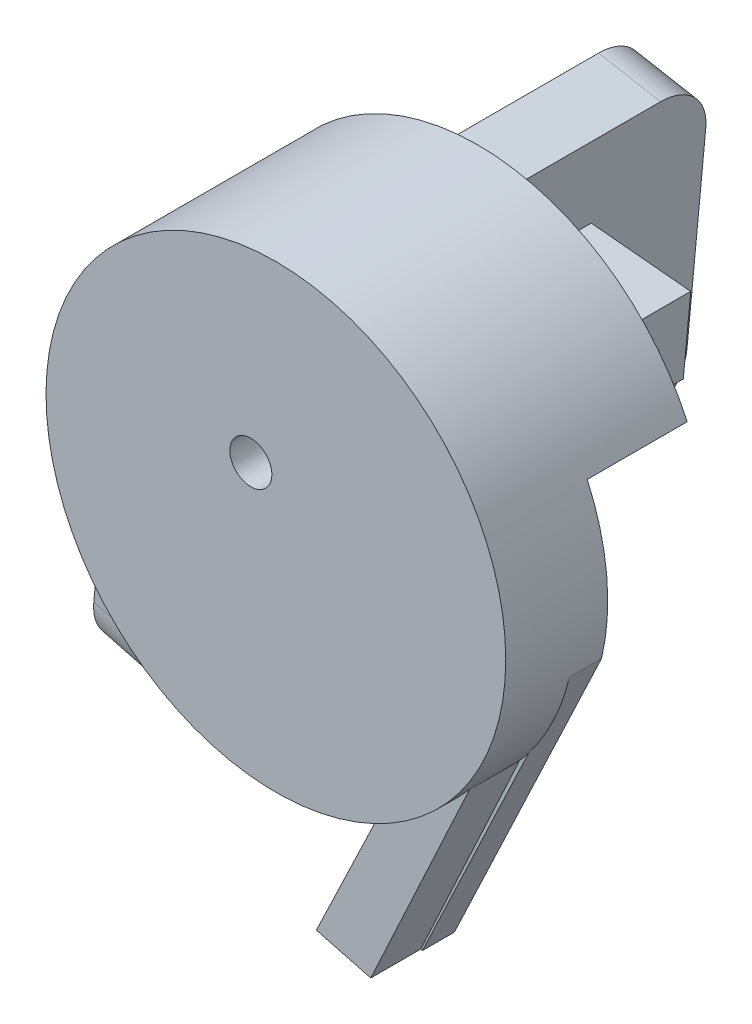
from build123d import *

# Parameters (mm, degrees)
BOSS_EXTRUDE3_DEPTH  = 13.2
BOSS_EXTRUDE4_DEPTH  = 40
SKETCH3_R            = 23
BOSS_EXTRUDE5_DEPTH  = 7
SKETCH4_R            = 2.101716342
CUT_EXTRUDE1_DEPTH   = 10
SKETCH6_W            = 25.714942096
SKETCH6_H            = 53.927163671
CUT_EXTRUDE2_DEPTH   = 10
BOSS_EXTRUDE6_DEPTH  = 5
BOSS_EXTRUDE10_DEPTH = 10
FILLET4_R            = 3
SKETCH10_R           = 1.4
CUT_EXTRUDE4_DEPTH   = 10
SKETCH11_W           = 0.356169872
SKETCH11_H           = 3.96875
SKETCH11_W_2         = 1.526442308
SKETCH11_H_2         = 0.407051282
CUT_EXTRUDE5_DEPTH   = 5
FILLET5_R            = 5
FILLET6_R            = 5
FILLET7_R            = 5


with BuildPart() as part:
    # Sketch1 → Boss-Extrude3 (new body)
    with BuildSketch(Plane.XY):
        with BuildLine():
            ThreePointArc((-16.733879942, 0.734685024), (4.365374373, 16.171147349), (14.830379862, -7.786034495))
            Line((14.830379862, -7.786034495), (1.98558973, -34.897127547))
            Line((1.98558973, -34.897127547), (7.660402975, -36.381590217))
            Line((7.660402975, -36.381590217), (22.375667903, -5.322545058))
            ThreePointArc((22.375667903, -5.322545058), (3.672252171, 22.704945805), (-22.912677541, 2.002300652))
            Line((-22.912677541, 2.002300652), (-25.690659105, -27.657354808))
            Line((-25.690659105, -27.657354808), (-19.543738844, -29.265314976))
            Line((-19.543738844, -29.265314976), (-16.733879942, 0.734685024))
        make_face()
    extrude(amount=BOSS_EXTRUDE3_DEPTH)

    # Sketch2 → Boss-Extrude4 (add)
    with BuildSketch(Plane(origin=(0, 0, 0), x_dir=(-1, 0, 0), z_dir=(0, 0, -1))):
        Polygon((22.912677541, 2.002300652), (16.720636216, 0.876084213), (19.543738844, -29.265314976), (25.690659105, -27.657354808), align=None)
    extrude(amount=BOSS_EXTRUDE4_DEPTH)

    # Sketch3 → Boss-Extrude5 (add)
    with BuildSketch(Plane.XY.offset(13.2)):
        Circle(SKETCH3_R)
    extrude(amount=BOSS_EXTRUDE5_DEPTH)

    # Sketch4 → Cut-Extrude1 (cut)
    with BuildSketch(Plane.XY.offset(20.2)):
        with Locations((-2.506003926, 4.326655096)):
            Circle(SKETCH4_R)
    extrude(amount=-CUT_EXTRUDE1_DEPTH, mode=Mode.SUBTRACT)

    # Sketch6 → Cut-Extrude2 (cut)
    with BuildSketch(Plane(origin=(0, 0, 0), x_dir=(-1, 0, 0), z_dir=(0, 0, -1))):
        with Locations((-13.331770184, -17.473361846)):
            Rectangle(SKETCH6_W, SKETCH6_H)
    extrude(amount=-CUT_EXTRUDE2_DEPTH, mode=Mode.SUBTRACT)

    # Sketch7 → Boss-Extrude6 (add)
    with BuildSketch(Plane.XY.offset(13.2)):
        with BuildLine():
            Line((8.554145329, -21.350095964), (2.050563603, -34.914123928))
            Line((2.050563603, -34.914123928), (7.494260499, -36.33812935))
            Line((7.494260499, -36.33812935), (17.377955101, -15.066740739))
            ThreePointArc((17.377955101, -15.066740739), (13.34123669, -18.735298332), (8.554145329, -21.350095964))
        make_face()
    extrude(amount=BOSS_EXTRUDE6_DEPTH)

    # Sketch8 → Boss-Extrude10 (add)
    with BuildSketch(Plane(origin=(-16.656571158, 1.560087158, 0), x_dir=(0, 0, -1), z_dir=(0.9956423681399388, -0.09325381903544164, 0))):
        Polygon((28.8, -16.5), (28.8, -8.5), (13.8, -8.5), (11.347917338, -14.810453646), (11.536154201, -16.5), align=None)
    extrude(amount=BOSS_EXTRUDE10_DEPTH)

    # Fillet4
    fillet4_edges = [part.edges().sort_by_distance(p)[0] for p in [
        (-12.471016779, -7.369142066, -13.8),
    ]]
    fillet(fillet4_edges, radius=FILLET4_R)

    # Sketch10 → Cut-Extrude4 (cut)
    with BuildSketch(Plane(origin=(-6.700147476, 0.627548968, 0), x_dir=(0, 0, -1), z_dir=(0.9956423681399388, -0.09325381903544165, 0))):
        with Locations((21.360043427, -12.580496566)):
            Circle(SKETCH10_R)
    extrude(amount=-CUT_EXTRUDE4_DEPTH, mode=Mode.SUBTRACT)

    # Sketch11 → Cut-Extrude5 (cut)
    # profile 1 of 10: a face of its own
    with BuildSketch(Plane(origin=(-22.899331118, 2.144796313, 0), x_dir=(0, 0, 1), z_dir=(-0.9956423681399388, 0.09325381903544164, 0))):
        with BuildLine():
            Line((-27.490761449, -14.449425234), (-27.796049911, -14.738813255))
            add(Edge.make_bspline(
                [(-27.796049911, -14.738813255), (-27.85129365, -14.68684433), (-27.96046381, -14.584145708), (-28.138445513, -14.450896634), (-28.324141777, -14.336748466), (-28.516583626, -14.243872645), (-28.711005379, -14.169767282), (-28.904826402, -14.117007695), (-29.096058582, -14.083361157), (-29.223248195, -14.079337559), (-29.285921205, -14.077354922)],
                knots=[0, 0, 0, 0, 1.08915593, 2.152340314, 3.188132944, 4.216796309, 5.218260357, 6.173443236, 7.099959455, 8, 8, 8, 8], degree=3))
            add(Edge.make_bspline(
                [(-29.285921205, -14.077354922), (-29.324378052, -14.077823921), (-29.401192007, -14.078760704), (-29.515290104, -14.090717091), (-29.628191559, -14.107912963), (-29.739683243, -14.132793485), (-29.849981933, -14.164326972), (-29.958704016, -14.203771203), (-30.066052303, -14.249757953), (-30.171015627, -14.302896651), (-30.272774948, -14.36127112), (-30.368883145, -14.42596009), (-30.459952803, -14.494890236), (-30.544272214, -14.569787329), (-30.622326399, -14.649972935), (-30.695973213, -14.733955434), (-30.762622468, -14.824029298), (-30.822824057, -14.918537284), (-30.87652875, -15.015819499), (-30.923936776, -15.114939585), (-30.963734367, -15.215568777), (-30.995222946, -15.317833348), (-31.021201991, -15.420942141), (-31.039478206, -15.525609101), (-31.0497819, -15.631946298), (-31.051564187, -15.703153904), (-31.052460167, -15.738950975)],
                knots=[0, 0, 0, 0, 1.02818874, 2.053710826, 3.065248034, 4.081641283, 5.106893873, 6.131558223, 7.173050175, 8.228653731, 9.27666206, 10.308777013, 11.325269123, 12.329503258, 13.32196095, 14.316845687, 15.314881793, 16.315733098, 17.311955233, 18.285320748, 19.252783886, 20.203351036, 21.145449891, 22.095197417, 23.042428769, 24, 24, 24, 24], degree=3))
            add(Edge.make_bspline(
                [(-31.052460167, -15.738950975), (-31.051603236, -15.775543777), (-31.049891715, -15.848629457), (-31.038937603, -15.957706665), (-31.018608259, -16.065163862), (-30.991430589, -16.171354156), (-30.957434486, -16.27645941), (-30.915056552, -16.380023953), (-30.864862523, -16.48204395), (-30.806763932, -16.581600176), (-30.743052791, -16.678577176), (-30.671679833, -16.769925919), (-30.595864707, -16.856862836), (-30.512845374, -16.937457676), (-30.425283929, -17.013866201), (-30.330564295, -17.083983266), (-30.230549005, -17.149159466), (-30.12508547, -17.208573376), (-30.015318029, -17.261650912), (-29.902767961, -17.308849437), (-29.787075706, -17.347719757), (-29.668849263, -17.379399571), (-29.548229571, -17.405366873), (-29.424604366, -17.422072453), (-29.298882634, -17.434195092), (-29.214134364, -17.43508145), (-29.171438032, -17.435527998)],
                knots=[0, 0, 0, 0, 0.93586088, 1.869166235, 2.799637598, 3.729985548, 4.670839027, 5.622275134, 6.589130586, 7.576015415, 8.568469353, 9.55398029, 10.53834874, 11.515998671, 12.510579167, 13.508179873, 14.527009472, 15.561807829, 16.601455013, 17.643573243, 18.680854198, 19.719860599, 20.772568776, 21.833555941, 22.908541556, 24, 24, 24, 24], degree=3))
            add(Edge.make_bspline(
                [(-29.171438032, -17.435527998), (-29.119982227, -17.434452381), (-29.018940395, -17.43234023), (-28.870411125, -17.415897938), (-28.727759429, -17.390218092), (-28.591386145, -17.352610334), (-28.461132881, -17.304640988), (-28.336522135, -17.246815862), (-28.218534986, -17.176917036), (-28.106816744, -17.098025241), (-28.003904579, -17.010128957), (-27.911087849, -16.91528212), (-27.829846982, -16.813945116), (-27.758971117, -16.706714803), (-27.700337197, -16.592703609), (-27.652210099, -16.472470257), (-27.61531967, -16.345960667), (-27.600176082, -16.258544263), (-27.59252427, -16.214374152)],
                knots=[0, 0, 0, 0, 1.13008108, 2.219097802, 3.278683437, 4.311054135, 5.322181354, 6.324827112, 7.324222904, 8.330512327, 9.32562643, 10.293043162, 11.24128371, 12.174520618, 13.111833804, 14.052305215, 15.015860969, 16, 16, 16, 16], degree=3))
            Line((-27.59252427, -16.214374152), (-28.915440936, -16.214374152))
            Line((-28.915440936, -16.214374152), (-28.915440936, -15.80732287))
            Line((-28.915440936, -15.80732287), (-27.236354398, -15.80732287))
            add(Edge.make_bspline(
                [(-27.236354398, -15.80732287), (-27.238288708, -15.883191183), (-27.242074503, -16.031679177), (-27.26862988, -16.248225824), (-27.311511104, -16.45275444), (-27.370090207, -16.645480423), (-27.445921999, -16.826130658), (-27.538192633, -16.99488856), (-27.648378878, -17.150663903), (-27.772555896, -17.294728398), (-27.91191567, -17.42323563), (-28.062692587, -17.536181649), (-28.225135757, -17.631321222), (-28.399091521, -17.708723937), (-28.583990405, -17.769132842), (-28.780260264, -17.811963112), (-28.987634936, -17.837623874), (-29.129757775, -17.840902492), (-29.202443891, -17.84257928)],
                knots=[0, 0, 0, 0, 1.140356446, 2.231883559, 3.274166699, 4.278491846, 5.25512956, 6.21435461, 7.1637429, 8.11826594, 9.068280886, 10.0076534, 10.945064095, 11.891975133, 12.864533718, 13.863980011, 14.907571808, 16, 16, 16, 16], degree=3))
            add(Edge.make_bspline(
                [(-29.202443891, -17.84257928), (-29.247245562, -17.841933938), (-29.335608898, -17.840661114), (-29.466113789, -17.831615371), (-29.593020377, -17.817690075), (-29.716310173, -17.79666123), (-29.836436686, -17.770904434), (-29.952799965, -17.737922173), (-30.06584328, -17.699744273), (-30.175741353, -17.656319714), (-30.281496687, -17.606005425), (-30.383580327, -17.550091816), (-30.482556559, -17.488867202), (-30.577751183, -17.421272761), (-30.6696602, -17.347814078), (-30.75769098, -17.26834392), (-30.842336342, -17.18310524), (-30.895359368, -17.122577255), (-30.922076553, -17.092078479)],
                knots=[0, 0, 0, 0, 1.107784379, 2.184907829, 3.233506516, 4.263428166, 5.276301166, 6.270063455, 7.25232949, 8.225834625, 9.190232166, 10.146266622, 11.1027726, 12.066435141, 13.031522626, 14.010570082, 14.99756817, 16, 16, 16, 16], degree=3))
            add(Edge.make_bspline(
                [(-30.922076553, -17.092078479), (-30.960840958, -17.043693007), (-31.037726319, -16.94772521), (-31.136693514, -16.793964559), (-31.221059391, -16.634758878), (-31.289512189, -16.469664969), (-31.342963412, -16.298837255), (-31.381297288, -16.122494023), (-31.403757339, -15.940408192), (-31.406993047, -15.817189543), (-31.408630039, -15.754851416)],
                knots=[0, 0, 0, 0, 1.023165419, 2.029347347, 3.013907458, 3.994755782, 4.975994455, 5.96558838, 6.970761222, 8, 8, 8, 8], degree=3))
            add(Edge.make_bspline(
                [(-31.408630039, -15.754851416), (-31.408026519, -15.708171826), (-31.406827149, -15.615405915), (-31.39228393, -15.477682004), (-31.371418036, -15.34240354), (-31.340748608, -15.209681106), (-31.30208588, -15.07942606), (-31.253833266, -14.951577922), (-31.197652893, -14.826061246), (-31.132355053, -14.703739985), (-31.059687854, -14.586237303), (-30.980822872, -14.474026222), (-30.894640218, -14.369150229), (-30.802547303, -14.270281128), (-30.703445358, -14.178661007), (-30.598262797, -14.093441613), (-30.48691856, -14.014508635), (-30.369062356, -13.94310534), (-30.246453286, -13.878966235), (-30.119385248, -13.822735611), (-29.987897033, -13.776263458), (-29.852973733, -13.736832476), (-29.713594067, -13.707673343), (-29.570769485, -13.686526998), (-29.423755518, -13.67205739), (-29.324382521, -13.670893689), (-29.273995874, -13.670303639)],
                knots=[0, 0, 0, 0, 1.008945113, 2.00506715, 2.99143336, 3.967273523, 4.948097931, 5.927297278, 6.919902385, 7.919676788, 8.923139349, 9.905703106, 10.883022732, 11.856032218, 12.825136022, 13.798837087, 14.781400844, 15.773989409, 16.776158564, 17.77167057, 18.775803737, 19.789618931, 20.80898985, 21.851988756, 22.910860228, 24, 24, 24, 24], degree=3))
            add(Edge.make_bspline(
                [(-29.273995874, -13.670303639), (-29.232904294, -13.670960742), (-29.15142452, -13.672263698), (-29.030178377, -13.68129504), (-28.910806298, -13.69560962), (-28.793131285, -13.715143565), (-28.677554066, -13.741749714), (-28.563745391, -13.773588483), (-28.451540283, -13.810658675), (-28.341290393, -13.854869242), (-28.232254412, -13.905049692), (-28.123826075, -13.961534555), (-28.016375858, -14.025289694), (-27.909717424, -14.096504417), (-27.803178192, -14.173955614), (-27.698443285, -14.259858441), (-27.59298459, -14.350825316), (-27.525173604, -14.416232792), (-27.490761449, -14.449425234)],
                knots=[0, 0, 0, 0, 0.985871117, 1.954866573, 2.915460327, 3.869826059, 4.81536089, 5.759505086, 6.70452669, 7.649098992, 8.607881297, 9.583363685, 10.581137262, 11.603961102, 12.659522466, 13.73993555, 14.853081303, 16, 16, 16, 16], degree=3))
        make_face()
    # profile 2 of 10: a face of its own
    with BuildSketch(Plane(origin=(-22.899331118, 2.144796313, 0), x_dir=(0, 0, 1), z_dir=(-0.9956423681399388, 0.09325381903544164, 0))):
        with Locations((-26.244166898, -15.75644146)):
            Rectangle(SKETCH11_W, SKETCH11_H)
    # profile 3 of 10: a face of its own
    with BuildSketch(Plane(origin=(-22.899331118, 2.144796313, 0), x_dir=(0, 0, 1), z_dir=(-0.9956423681399388, 0.09325381903544164, 0))):
        Polygon((-23.420248629, -13.77206646), (-21.588517859, -17.74081646), (-21.975693591, -17.74081646), (-22.562419853, -16.468781204), (-24.361554718, -16.468781204), (-24.964976443, -17.74081646), (-25.353742218, -17.74081646), (-23.471130039, -13.77206646), align=None)
        Polygon((-23.449664444, -14.5456229), (-24.168364364, -16.061729922), (-22.750045053, -16.061729922), align=None, mode=Mode.SUBTRACT)
    # profile 4 of 10: a face of its own
    with BuildSketch(Plane(origin=(-22.899331118, 2.144796313, 0), x_dir=(0, 0, 1), z_dir=(-0.9956423681399388, 0.09325381903544164, 0))):
        with BuildLine():
            Line((-20.876178116, -13.77206646), (-20.520008244, -13.77206646))
            Line((-20.520008244, -13.77206646), (-20.520008244, -16.149977367))
            add(Edge.make_bspline(
                [(-20.520008244, -16.149977367), (-20.520061248, -16.183633202), (-20.520161833, -16.247500947), (-20.519489965, -16.338406074), (-20.517608359, -16.419223951), (-20.516422089, -16.490266104), (-20.513783059, -16.551206541), (-20.51163081, -16.60237542), (-20.508863393, -16.643530453), (-20.505537447, -16.667548111), (-20.504107803, -16.677871999)],
                knots=[0, 0, 0, 0, 1.528628734, 2.90083645, 4.128790002, 5.200304208, 6.127813768, 6.898992206, 7.526736466, 8, 8, 8, 8], degree=3))
            add(Edge.make_bspline(
                [(-20.504107803, -16.677871999), (-20.498236935, -16.715117882), (-20.486826, -16.787510977), (-20.45774484, -16.890594475), (-20.417130352, -16.983498897), (-20.369002973, -17.069123307), (-20.305579387, -17.145084456), (-20.229602164, -17.215061063), (-20.137552373, -17.276261234), (-20.035203293, -17.332221529), (-19.924888783, -17.3771989), (-19.812163508, -17.411209232), (-19.698721915, -17.431936199), (-19.622775728, -17.434336203), (-19.58506233, -17.435527998)],
                knots=[0, 0, 0, 0, 1.035780045, 2.013197591, 2.933192213, 3.817615948, 4.702609284, 5.640816605, 6.646850145, 7.73207398, 8.84249596, 9.914020372, 10.964143139, 12, 12, 12, 12], degree=3))
            add(Edge.make_bspline(
                [(-19.58506233, -17.435527998), (-19.552684428, -17.434310329), (-19.488115631, -17.431882023), (-19.392177981, -17.416844507), (-19.298742144, -17.389742973), (-19.20734673, -17.35477289), (-19.12167731, -17.308568032), (-19.041686086, -17.255193062), (-18.970289482, -17.192587872), (-18.905136217, -17.123304446), (-18.848400173, -17.045131637), (-18.799220397, -16.959771606), (-18.75893653, -16.865939757), (-18.739043426, -16.799996796), (-18.728823599, -16.766119445)],
                knots=[0, 0, 0, 0, 0.994687771, 1.983630487, 2.973142513, 3.978332533, 4.983357753, 5.956394766, 6.925816176, 7.893390482, 8.871859704, 9.88551698, 10.913711441, 12, 12, 12, 12], degree=3))
            add(Edge.make_bspline(
                [(-18.728823599, -16.766119445), (-18.725421671, -16.752117043), (-18.717840805, -16.720914051), (-18.710757102, -16.66816223), (-18.703379167, -16.605921612), (-18.698259967, -16.533745003), (-18.693269297, -16.451874257), (-18.690283581, -16.359882876), (-18.688903552, -16.258104893), (-18.688492299, -16.187078826), (-18.688277475, -16.149977367)],
                knots=[0, 0, 0, 0, 0.558680831, 1.244966039, 2.062412453, 2.990489873, 4.051219941, 5.244515665, 6.560634259, 8, 8, 8, 8], degree=3))
            Line((-18.688277475, -16.149977367), (-18.688277475, -13.77206646))
            Line((-18.688277475, -13.77206646), (-18.332107603, -13.77206646))
            Line((-18.332107603, -13.77206646), (-18.332107603, -16.169057896))
            add(Edge.make_bspline(
                [(-18.332107603, -16.169057896), (-18.332395757, -16.212258737), (-18.332958108, -16.296567803), (-18.337834655, -16.420110862), (-18.345610003, -16.537305761), (-18.356595602, -16.648168252), (-18.371151847, -16.752301629), (-18.387338927, -16.850618643), (-18.407953219, -16.942413555), (-18.43203038, -17.0284021), (-18.459554849, -17.110255316), (-18.495206866, -17.187939191), (-18.535375718, -17.263815341), (-18.583017334, -17.336736143), (-18.636551669, -17.407024466), (-18.697162057, -17.474254043), (-18.762843918, -17.539499211), (-18.834689133, -17.601086349), (-18.91151339, -17.65756583), (-18.993088163, -17.707229374), (-19.078786822, -17.749211512), (-19.168386599, -17.783769034), (-19.26192573, -17.809752552), (-19.359406576, -17.829114559), (-19.461051018, -17.840116272), (-19.530180584, -17.841751317), (-19.56518678, -17.84257928)],
                knots=[0, 0, 0, 0, 1.316592851, 2.569410997, 3.76748051, 4.895814652, 5.963796859, 6.97159953, 7.931736103, 8.829262218, 9.692595152, 10.560224239, 11.431080259, 12.30701507, 13.211635791, 14.121146779, 15.063487852, 16.031507147, 17.00238618, 17.966455255, 18.938106653, 19.907068911, 20.888905087, 21.893141452, 22.933117798, 24, 24, 24, 24], degree=3))
            add(Edge.make_bspline(
                [(-19.56518678, -17.84257928), (-19.603365137, -17.841689413), (-19.678270938, -17.839943495), (-19.788645353, -17.829939127), (-19.894456987, -17.811095055), (-19.996823383, -17.78710119), (-20.094350875, -17.754008917), (-20.18834612, -17.715344079), (-20.277199267, -17.667858257), (-20.362351779, -17.615024677), (-20.441528065, -17.555578882), (-20.514209942, -17.490786006), (-20.580517403, -17.421683971), (-20.639332799, -17.347524628), (-20.691630588, -17.268884746), (-20.736681812, -17.185541858), (-20.775363794, -17.097528231), (-20.795328384, -17.036349156), (-20.805421155, -17.005421077)],
                knots=[0, 0, 0, 0, 1.13879206, 2.234305948, 3.301075583, 4.341971843, 5.366689343, 6.369221514, 7.369726634, 8.367512178, 9.355451585, 10.318319045, 11.268648973, 12.207971039, 13.137398894, 14.081662264, 15.030215811, 16, 16, 16, 16], degree=3))
            add(Edge.make_bspline(
                [(-20.805421155, -17.005421077), (-20.811291682, -16.984293069), (-20.824024987, -16.938465948), (-20.837660816, -16.862621447), (-20.849123792, -16.775292032), (-20.859902416, -16.676471724), (-20.866262574, -16.566083928), (-20.871838598, -16.444176497), (-20.876217398, -16.310602023), (-20.876191576, -16.217558063), (-20.876178116, -16.169057896)],
                knots=[0, 0, 0, 0, 0.625038921, 1.35572334, 2.194682327, 3.136881307, 4.189498639, 5.346923369, 6.617055217, 8, 8, 8, 8], degree=3))
            Line((-20.876178116, -16.169057896), (-20.876178116, -13.77206646))
        make_face()
    # profile 5 of 10: a face of its own
    with BuildSketch(Plane(origin=(-22.899331118, 2.144796313, 0), x_dir=(0, 0, 1), z_dir=(-0.9956423681399388, 0.09325381903544164, 0))):
        with Locations((-16.907428116, -16.214374152)):
            Rectangle(SKETCH11_W_2, SKETCH11_H_2)
    # profile 6 of 10: a face of its own
    with BuildSketch(Plane(origin=(-22.899331118, 2.144796313, 0), x_dir=(0, 0, 1), z_dir=(-0.9956423681399388, 0.09325381903544164, 0))):
        with BuildLine():
            Line((-12.17466194, -17.298784208), (-11.564880039, -18.046104922))
            Line((-11.564880039, -18.046104922), (-12.009297357, -18.046104922))
            Line((-12.009297357, -18.046104922), (-12.449739564, -17.507079982))
            add(Edge.make_bspline(
                [(-12.449739564, -17.507079982), (-12.493914125, -17.533924307), (-12.581449515, -17.587118463), (-12.717936684, -17.655682777), (-12.857138096, -17.71273723), (-12.998745753, -17.759874611), (-13.142553396, -17.79760532), (-13.28929026, -17.823792027), (-13.438424142, -17.838998322), (-13.538620794, -17.841381077), (-13.589006141, -17.84257928)],
                knots=[0, 0, 0, 0, 1.030216282, 2.041455142, 3.041201647, 4.026904037, 5.014869161, 6.002481075, 6.995518502, 8, 8, 8, 8], degree=3))
            add(Edge.make_bspline(
                [(-13.589006141, -17.84257928), (-13.66119242, -17.840840575), (-13.803233529, -17.837419321), (-14.011842501, -17.807551124), (-14.212075712, -17.761422321), (-14.403534053, -17.694678532), (-14.586426086, -17.609426967), (-14.760666841, -17.504323949), (-14.926344878, -17.380825276), (-15.081014538, -17.239738051), (-15.222444253, -17.086254803), (-15.346539965, -16.922264875), (-15.452054849, -16.750489484), (-15.537369919, -16.570072038), (-15.605078829, -16.3825832), (-15.651220615, -16.186463683), (-15.681087656, -15.982880958), (-15.684528412, -15.844265934), (-15.68627427, -15.773931945)],
                knots=[0, 0, 0, 0, 1.055750571, 2.07740284, 3.077223765, 4.05828044, 5.038417088, 6.02463293, 7.030503776, 8.057169806, 9.083586829, 10.080154041, 11.061747002, 12.027853603, 12.995569715, 13.972756451, 14.971366004, 16, 16, 16, 16], degree=3))
            add(Edge.make_bspline(
                [(-15.68627427, -15.773931945), (-15.685653112, -15.726725043), (-15.684415161, -15.632642907), (-15.670094605, -15.493297632), (-15.648817807, -15.356246341), (-15.618722602, -15.222058564), (-15.579325468, -15.090184284), (-15.532092373, -14.960883537), (-15.47486319, -14.834489499), (-15.410166988, -14.711260858), (-15.338012165, -14.592265645), (-15.259412278, -14.479197478), (-15.174173965, -14.373170651), (-15.082357568, -14.274233676), (-14.984329773, -14.182167851), (-14.88093354, -14.095457129), (-14.769964255, -14.01732724), (-14.65435074, -13.944669577), (-14.533444649, -13.880777223), (-14.409610901, -13.823659501), (-14.281923153, -13.777315667), (-14.152038164, -13.737825106), (-14.019167936, -13.707676316), (-13.883416023, -13.686555491), (-13.744877926, -13.672096806), (-13.651320155, -13.670905011), (-13.604111559, -13.670303639)],
                knots=[0, 0, 0, 0, 1.030721839, 2.054201982, 3.056261636, 4.058906239, 5.055198403, 6.060579377, 7.06322398, 8.083343201, 9.098870418, 10.10084648, 11.0888991, 12.067804703, 13.046436456, 14.024708667, 15.012489976, 16.008294399, 17.005242112, 17.997338632, 18.984424362, 19.969624474, 20.960977749, 21.957320355, 22.969278161, 24, 24, 24, 24], degree=3))
            add(Edge.make_bspline(
                [(-13.604111559, -13.670303639), (-13.53192501, -13.672033616), (-13.390146009, -13.675431399), (-13.18205383, -13.7053041), (-12.982410497, -13.751618009), (-12.791358132, -13.818021656), (-12.609067075, -13.903487915), (-12.435613909, -14.008569748), (-12.270729715, -14.132076602), (-12.116868253, -14.273173274), (-11.975771633, -14.427034728), (-11.852264585, -14.591918901), (-11.74718346, -14.765372159), (-11.661714579, -14.94766287), (-11.595320801, -15.138716539), (-11.548909755, -15.338610937), (-11.519179691, -15.546989497), (-11.515744445, -15.689027096), (-11.513998629, -15.761211592)],
                knots=[0, 0, 0, 0, 1.050672203, 2.063587442, 3.054842799, 4.031180399, 5.003107577, 5.981273811, 6.979214548, 7.998088659, 9.016962771, 10.014903508, 10.993069742, 11.96499692, 12.941334519, 13.932589877, 14.949327797, 16, 16, 16, 16], degree=3))
            add(Edge.make_bspline(
                [(-11.513998629, -15.761211592), (-11.515906597, -15.836320034), (-11.51965851, -15.984016533), (-11.551587929, -16.200597713), (-11.602924829, -16.407483759), (-11.675726754, -16.60453912), (-11.76984319, -16.791727977), (-11.883455877, -16.970922238), (-12.017932725, -17.142109198), (-12.12186868, -17.246009207), (-12.17466194, -17.298784208)],
                knots=[0, 0, 0, 0, 1.045660934, 2.056233022, 3.041853582, 4.009978652, 4.97562384, 5.954545411, 6.961031197, 8, 8, 8, 8], degree=3))
        make_face()
        with BuildLine():
            add(Edge.make_bspline(
                [(-12.413963572, -17.005421077), (-12.370660336, -16.961443956), (-12.28548095, -16.874939009), (-12.174962372, -16.733075472), (-12.079905308, -16.5856112), (-12.003801779, -16.430584568), (-11.943251046, -16.269937831), (-11.90141714, -16.102398087), (-11.875223298, -15.928728057), (-11.871865821, -15.81059611), (-11.8701685, -15.750876306)],
                knots=[0, 0, 0, 0, 1.052210109, 2.069743939, 3.061837814, 4.040478349, 5.010453814, 5.985306305, 6.981502329, 8, 8, 8, 8], degree=3))
            add(Edge.make_bspline(
                [(-11.8701685, -15.750876306), (-11.870611985, -15.712417494), (-11.871488676, -15.6363912), (-11.883543158, -15.523885622), (-11.900596665, -15.413864877), (-11.925284916, -15.30652554), (-11.957077316, -15.202085087), (-11.996343724, -15.100685296), (-12.042319095, -15.001999045), (-12.095916332, -14.906639367), (-12.155002751, -14.814744474), (-12.220773184, -14.727438199), (-12.292301874, -14.645170717), (-12.368807404, -14.566586298), (-12.451764799, -14.493304857), (-12.540876543, -14.425357806), (-12.635044577, -14.361100845), (-12.734734885, -14.303100644), (-12.837465718, -14.24977851), (-12.942635957, -14.203604841), (-13.049362522, -14.164497398), (-13.15748014, -14.132786284), (-13.266848906, -14.107825599), (-13.377660566, -14.090791174), (-13.489628561, -14.078749105), (-13.56485845, -14.077820046), (-13.602521515, -14.077354922)],
                knots=[0, 0, 0, 0, 1.032958288, 2.041976502, 3.037103433, 4.023477888, 4.998866292, 5.968231228, 6.943073582, 7.921783703, 8.90545537, 9.876780072, 10.85618943, 11.833110341, 12.821898168, 13.827467856, 14.842673888, 15.88323808, 16.924703457, 17.951432745, 18.967462636, 19.976958182, 20.977218729, 21.979378626, 22.98839684, 24, 24, 24, 24], degree=3))
            add(Edge.make_bspline(
                [(-13.602521515, -14.077354922), (-13.640448888, -14.077823291), (-13.716206211, -14.078758827), (-13.828714769, -14.090724571), (-13.939780742, -14.107844351), (-14.04891564, -14.132680979), (-14.156505948, -14.164453762), (-14.262217715, -14.203797631), (-14.366970265, -14.24883083), (-14.468589884, -14.302118917), (-14.566898775, -14.360617864), (-14.660396751, -14.4242359), (-14.747802489, -14.493607745), (-14.829945116, -14.567616518), (-14.906619467, -14.646833253), (-14.97818756, -14.730731003), (-15.043392535, -14.820283239), (-15.103132558, -14.913887729), (-15.155933624, -15.011646174), (-15.203553486, -15.111794779), (-15.242231392, -15.215437669), (-15.273985132, -15.321745289), (-15.299932744, -15.430453349), (-15.316656987, -15.542192897), (-15.328801891, -15.656266385), (-15.329666886, -15.733352159), (-15.330104398, -15.772341901)],
                knots=[0, 0, 0, 0, 1.013205451, 2.023808328, 3.020541854, 4.015386314, 5.012622987, 6.016502547, 7.02834558, 8.057881235, 9.080621846, 10.084476421, 11.077781791, 12.060654405, 13.037357686, 14.022218736, 15.005346502, 15.995617173, 16.98763393, 17.973029642, 18.956998942, 19.940662314, 20.93709383, 21.940823471, 22.958474994, 24, 24, 24, 24], degree=3))
            add(Edge.make_bspline(
                [(-15.330104398, -15.772341901), (-15.328614918, -15.829665291), (-15.325684652, -15.942438134), (-15.301393471, -16.108008131), (-15.260666258, -16.266516026), (-15.203687196, -16.418188584), (-15.132157799, -16.563900018), (-15.043205585, -16.702222842), (-14.937210049, -16.832630204), (-14.818181049, -16.956017825), (-14.687247372, -17.067802068), (-14.548444975, -17.166184407), (-14.40295892, -17.249653105), (-14.250332357, -17.317022083), (-14.091703427, -17.371121652), (-13.925819918, -17.407748141), (-13.753766215, -17.432025162), (-13.636527743, -17.434349447), (-13.57708081, -17.435527998)],
                knots=[0, 0, 0, 0, 1.022526523, 2.011626, 2.97850031, 3.937665323, 4.897797383, 5.869804095, 6.865337375, 7.89202157, 8.925035373, 9.93268082, 10.923937058, 11.912550332, 12.905497077, 13.90928476, 14.939882052, 16, 16, 16, 16], degree=3))
            add(Edge.make_bspline(
                [(-13.57708081, -17.435527998), (-13.536238513, -17.435083078), (-13.455455333, -17.434203057), (-13.336331595, -17.422205391), (-13.220122938, -17.40531843), (-13.107905482, -17.379635015), (-12.998706129, -17.347704882), (-12.893174867, -17.308864757), (-12.790751892, -17.262819463), (-12.725626894, -17.226392217), (-12.693016307, -17.208151696)],
                knots=[0, 0, 0, 0, 1.060694673, 2.097979151, 3.107774411, 4.11000626, 5.086069662, 6.061987343, 7.029562652, 8, 8, 8, 8], degree=3))
            Line((-12.693016307, -17.208151696), (-13.586621074, -16.112611332))
            Line((-13.586621074, -16.112611332), (-13.142203757, -16.112611332))
            Line((-13.142203757, -16.112611332), (-12.413963572, -17.005421077))
        make_face(mode=Mode.SUBTRACT)
    # profile 7 of 10: a face of its own
    with BuildSketch(Plane(origin=(-22.899331118, 2.144796313, 0), x_dir=(0, 0, 1), z_dir=(-0.9956423681399388, 0.09325381903544164, 0))):
        with BuildLine():
            Line((-10.699896064, -13.77206646), (-10.343726193, -13.77206646))
            Line((-10.343726193, -13.77206646), (-10.343726193, -16.149977367))
            add(Edge.make_bspline(
                [(-10.343726193, -16.149977367), (-10.343779197, -16.183633202), (-10.343879782, -16.247500947), (-10.343207913, -16.338406074), (-10.341326308, -16.419223951), (-10.340140038, -16.490266104), (-10.337501008, -16.551206541), (-10.335348758, -16.60237542), (-10.332581341, -16.643530453), (-10.329255396, -16.667548111), (-10.327825752, -16.677871999)],
                knots=[0, 0, 0, 0, 1.528628734, 2.90083645, 4.128790002, 5.200304208, 6.127813768, 6.898992206, 7.526736466, 8, 8, 8, 8], degree=3))
            add(Edge.make_bspline(
                [(-10.327825752, -16.677871999), (-10.321954883, -16.715117882), (-10.310543949, -16.787510977), (-10.281462788, -16.890594475), (-10.240848301, -16.983498897), (-10.192720922, -17.069123307), (-10.129297336, -17.145084456), (-10.053320113, -17.215061063), (-9.961270322, -17.276261234), (-9.858921242, -17.332221529), (-9.748606732, -17.3771989), (-9.635881456, -17.411209232), (-9.522439864, -17.431936199), (-9.446493677, -17.434336203), (-9.408780279, -17.435527998)],
                knots=[0, 0, 0, 0, 1.035780045, 2.013197591, 2.933192213, 3.817615948, 4.702609284, 5.640816605, 6.646850145, 7.73207398, 8.84249596, 9.914020372, 10.964143139, 12, 12, 12, 12], degree=3))
            add(Edge.make_bspline(
                [(-9.408780279, -17.435527998), (-9.376402377, -17.434310329), (-9.311833579, -17.431882023), (-9.21589593, -17.416844507), (-9.122460093, -17.389742973), (-9.031064679, -17.35477289), (-8.945395259, -17.308568032), (-8.865404035, -17.255193062), (-8.794007431, -17.192587872), (-8.728854165, -17.123304446), (-8.672118122, -17.045131637), (-8.622938345, -16.959771606), (-8.582654479, -16.865939757), (-8.562761375, -16.799996796), (-8.552541547, -16.766119445)],
                knots=[0, 0, 0, 0, 0.994687771, 1.983630487, 2.973142513, 3.978332533, 4.983357753, 5.956394766, 6.925816176, 7.893390482, 8.871859704, 9.88551698, 10.913711441, 12, 12, 12, 12], degree=3))
            add(Edge.make_bspline(
                [(-8.552541547, -16.766119445), (-8.549139619, -16.752117043), (-8.541558753, -16.720914051), (-8.534475051, -16.66816223), (-8.527097115, -16.605921612), (-8.521977916, -16.533745003), (-8.516987246, -16.451874257), (-8.51400153, -16.359882876), (-8.512621501, -16.258104893), (-8.512210248, -16.187078826), (-8.511995423, -16.149977367)],
                knots=[0, 0, 0, 0, 0.558680831, 1.244966039, 2.062412453, 2.990489873, 4.051219941, 5.244515665, 6.560634259, 8, 8, 8, 8], degree=3))
            Line((-8.511995423, -16.149977367), (-8.511995423, -13.77206646))
            Line((-8.511995423, -13.77206646), (-8.155825552, -13.77206646))
            Line((-8.155825552, -13.77206646), (-8.155825552, -16.169057896))
            add(Edge.make_bspline(
                [(-8.155825552, -16.169057896), (-8.156113706, -16.212258737), (-8.156676057, -16.296567803), (-8.161552603, -16.420110862), (-8.169327951, -16.537305761), (-8.180313551, -16.648168252), (-8.194869796, -16.752301629), (-8.211056876, -16.850618643), (-8.231671168, -16.942413555), (-8.255748328, -17.0284021), (-8.283272798, -17.110255316), (-8.318924814, -17.187939191), (-8.359093667, -17.263815341), (-8.406735282, -17.336736143), (-8.460269618, -17.407024466), (-8.520880006, -17.474254043), (-8.586561867, -17.539499211), (-8.658407082, -17.601086349), (-8.735231338, -17.65756583), (-8.816806112, -17.707229374), (-8.90250477, -17.749211512), (-8.992104547, -17.783769034), (-9.085643679, -17.809752552), (-9.183124525, -17.829114559), (-9.284768967, -17.840116272), (-9.353898532, -17.841751317), (-9.388904728, -17.84257928)],
                knots=[0, 0, 0, 0, 1.316592851, 2.569410997, 3.76748051, 4.895814652, 5.963796859, 6.97159953, 7.931736103, 8.829262218, 9.692595152, 10.560224239, 11.431080259, 12.30701507, 13.211635791, 14.121146779, 15.063487852, 16.031507147, 17.00238618, 17.966455255, 18.938106653, 19.907068911, 20.888905087, 21.893141452, 22.933117798, 24, 24, 24, 24], degree=3))
            add(Edge.make_bspline(
                [(-9.388904728, -17.84257928), (-9.427083086, -17.841689413), (-9.501988886, -17.839943495), (-9.612363302, -17.829939127), (-9.718174935, -17.811095055), (-9.820541332, -17.78710119), (-9.918068824, -17.754008917), (-10.012064069, -17.715344079), (-10.100917216, -17.667858257), (-10.186069728, -17.615024677), (-10.265246014, -17.555578882), (-10.337927891, -17.490786006), (-10.404235351, -17.421683971), (-10.463050748, -17.347524628), (-10.515348537, -17.268884746), (-10.560399761, -17.185541858), (-10.599081743, -17.097528231), (-10.619046332, -17.036349156), (-10.629139103, -17.005421077)],
                knots=[0, 0, 0, 0, 1.13879206, 2.234305948, 3.301075583, 4.341971843, 5.366689343, 6.369221514, 7.369726634, 8.367512178, 9.355451585, 10.318319045, 11.268648973, 12.207971039, 13.137398894, 14.081662264, 15.030215811, 16, 16, 16, 16], degree=3))
            add(Edge.make_bspline(
                [(-10.629139103, -17.005421077), (-10.635009631, -16.984293069), (-10.647742936, -16.938465948), (-10.661378765, -16.862621447), (-10.672841741, -16.775292032), (-10.683620365, -16.676471724), (-10.689980523, -16.566083928), (-10.695556547, -16.444176497), (-10.699935347, -16.310602023), (-10.699909525, -16.217558063), (-10.699896064, -16.169057896)],
                knots=[0, 0, 0, 0, 0.625038921, 1.35572334, 2.194682327, 3.136881307, 4.189498639, 5.346923369, 6.617055217, 8, 8, 8, 8], degree=3))
            Line((-10.699896064, -16.169057896), (-10.699896064, -13.77206646))
        make_face()
    # profile 8 of 10: a face of its own
    with BuildSketch(Plane(origin=(-22.899331118, 2.144796313, 0), x_dir=(0, 0, 1), z_dir=(-0.9956423681399388, 0.09325381903544164, 0))):
        Polygon((-5.509992218, -13.77206646), (-3.678261449, -17.74081646), (-4.06543718, -17.74081646), (-4.652163442, -16.468781204), (-6.451298308, -16.468781204), (-7.054720033, -17.74081646), (-7.443485808, -17.74081646), (-5.560873629, -13.77206646), align=None)
        Polygon((-5.539408034, -14.5456229), (-6.258107953, -16.061729922), (-4.839788643, -16.061729922), align=None, mode=Mode.SUBTRACT)
    # profile 9 of 10: a face of its own
    with BuildSketch(Plane(origin=(-22.899331118, 2.144796313, 0), x_dir=(0, 0, 1), z_dir=(-0.9956423681399388, 0.09325381903544164, 0))):
        Polygon((-2.965921705, -17.74081646), (-2.965921705, -13.77206646), (-2.891189634, -13.77206646), (-0.269206962, -16.895708036), (-0.269206962, -13.77206646), (0.08696291, -13.77206646), (0.08696291, -17.74081646), (0.005870662, -17.74081646), (-2.609751834, -14.624330082), (-2.609751834, -17.74081646), align=None)
    # profile 10 of 10: a face of its own
    with BuildSketch(Plane(origin=(-22.899331118, 2.144796313, 0), x_dir=(0, 0, 1), z_dir=(-0.9956423681399388, 0.09325381903544164, 0))):
        with BuildLine():
            Line((4.818934064, -14.449425234), (4.513645602, -14.738813255))
            add(Edge.make_bspline(
                [(4.513645602, -14.738813255), (4.458401863, -14.68684433), (4.349231703, -14.584145708), (4.171249999, -14.450896634), (3.985553736, -14.336748466), (3.793111887, -14.243872645), (3.598690134, -14.169767282), (3.404869111, -14.117007695), (3.213636931, -14.083361157), (3.086447318, -14.079337559), (3.023774308, -14.077354922)],
                knots=[0, 0, 0, 0, 1.08915593, 2.152340314, 3.188132944, 4.216796309, 5.218260357, 6.173443236, 7.099959455, 8, 8, 8, 8], degree=3))
            add(Edge.make_bspline(
                [(3.023774308, -14.077354922), (2.985317461, -14.077823921), (2.908503506, -14.078760704), (2.794405409, -14.090717091), (2.681503954, -14.107912963), (2.57001227, -14.132793485), (2.459713579, -14.164326972), (2.350991496, -14.203771203), (2.24364321, -14.249757953), (2.138679886, -14.302896651), (2.036920565, -14.36127112), (1.940812368, -14.42596009), (1.84974271, -14.494890236), (1.765423299, -14.569787329), (1.687369114, -14.649972935), (1.6137223, -14.733955434), (1.547073044, -14.824029298), (1.486871456, -14.918537284), (1.433166763, -15.015819499), (1.385758737, -15.114939585), (1.345961146, -15.215568777), (1.314472567, -15.317833348), (1.288493522, -15.420942141), (1.270217306, -15.525609101), (1.259913613, -15.631946298), (1.258131326, -15.703153904), (1.257235346, -15.738950975)],
                knots=[0, 0, 0, 0, 1.02818874, 2.053710826, 3.065248034, 4.081641283, 5.106893873, 6.131558223, 7.173050175, 8.228653731, 9.27666206, 10.308777013, 11.325269123, 12.329503258, 13.32196095, 14.316845687, 15.314881793, 16.315733098, 17.311955233, 18.285320748, 19.252783886, 20.203351036, 21.145449891, 22.095197417, 23.042428769, 24, 24, 24, 24], degree=3))
            add(Edge.make_bspline(
                [(1.257235346, -15.738950975), (1.258092276, -15.775543777), (1.259803797, -15.848629457), (1.27075791, -15.957706665), (1.291087254, -16.065163862), (1.318264924, -16.171354156), (1.352261027, -16.27645941), (1.394638961, -16.380023953), (1.44483299, -16.48204395), (1.50293158, -16.581600176), (1.566642722, -16.678577176), (1.63801568, -16.769925919), (1.713830806, -16.856862836), (1.796850139, -16.937457676), (1.884411584, -17.013866201), (1.979131218, -17.083983266), (2.079146508, -17.149159466), (2.184610043, -17.208573376), (2.294377484, -17.261650912), (2.406927552, -17.308849437), (2.522619807, -17.347719757), (2.64084625, -17.379399571), (2.761465942, -17.405366873), (2.885091147, -17.422072453), (3.010812879, -17.434195092), (3.095561149, -17.43508145), (3.138257481, -17.435527998)],
                knots=[0, 0, 0, 0, 0.93586088, 1.869166235, 2.799637598, 3.729985548, 4.670839027, 5.622275134, 6.589130586, 7.576015415, 8.568469353, 9.55398029, 10.53834874, 11.515998671, 12.510579167, 13.508179873, 14.527009472, 15.561807829, 16.601455013, 17.643573243, 18.680854198, 19.719860599, 20.772568776, 21.833555941, 22.908541556, 24, 24, 24, 24], degree=3))
            add(Edge.make_bspline(
                [(3.138257481, -17.435527998), (3.189713286, -17.434452381), (3.290755118, -17.43234023), (3.439284387, -17.415897938), (3.581936084, -17.390218092), (3.718309368, -17.352610334), (3.848562632, -17.304640988), (3.973173378, -17.246815862), (4.091160527, -17.176917036), (4.202878768, -17.098025241), (4.305790934, -17.010128957), (4.398607664, -16.91528212), (4.479848531, -16.813945116), (4.550724396, -16.706714803), (4.609358316, -16.592703609), (4.657485414, -16.472470257), (4.694375843, -16.345960667), (4.709519431, -16.258544263), (4.717171243, -16.214374152)],
                knots=[0, 0, 0, 0, 1.13008108, 2.219097802, 3.278683437, 4.311054135, 5.322181354, 6.324827112, 7.324222904, 8.330512327, 9.32562643, 10.293043162, 11.24128371, 12.174520618, 13.111833804, 14.052305215, 15.015860969, 16, 16, 16, 16], degree=3))
            Line((4.717171243, -16.214374152), (3.394254577, -16.214374152))
            Line((3.394254577, -16.214374152), (3.394254577, -15.80732287))
            Line((3.394254577, -15.80732287), (5.073341115, -15.80732287))
            add(Edge.make_bspline(
                [(5.073341115, -15.80732287), (5.071406805, -15.883191183), (5.06762101, -16.031679177), (5.041065633, -16.248225824), (4.998184409, -16.45275444), (4.939605305, -16.645480423), (4.863773514, -16.826130658), (4.771502879, -16.99488856), (4.661316635, -17.150663903), (4.537139616, -17.294728398), (4.397779843, -17.42323563), (4.247002926, -17.536181649), (4.084559756, -17.631321222), (3.910603992, -17.708723937), (3.725705108, -17.769132842), (3.529435249, -17.811963112), (3.322060577, -17.837623874), (3.179937738, -17.840902492), (3.107251622, -17.84257928)],
                knots=[0, 0, 0, 0, 1.140356446, 2.231883559, 3.274166699, 4.278491846, 5.25512956, 6.21435461, 7.1637429, 8.11826594, 9.068280886, 10.0076534, 10.945064095, 11.891975133, 12.864533718, 13.863980011, 14.907571808, 16, 16, 16, 16], degree=3))
            add(Edge.make_bspline(
                [(3.107251622, -17.84257928), (3.06244995, -17.841933938), (2.974086615, -17.840661114), (2.843581724, -17.831615371), (2.716675136, -17.817690075), (2.59338534, -17.79666123), (2.473258827, -17.770904434), (2.356895548, -17.737922173), (2.243852233, -17.699744273), (2.13395416, -17.656319714), (2.028198826, -17.606005425), (1.926115186, -17.550091816), (1.827138954, -17.488867202), (1.73194433, -17.421272761), (1.640035312, -17.347814078), (1.552004533, -17.26834392), (1.467359171, -17.18310524), (1.414336145, -17.122577255), (1.38761896, -17.092078479)],
                knots=[0, 0, 0, 0, 1.107784379, 2.184907829, 3.233506516, 4.263428166, 5.276301166, 6.270063455, 7.25232949, 8.225834625, 9.190232166, 10.146266622, 11.1027726, 12.066435141, 13.031522626, 14.010570082, 14.99756817, 16, 16, 16, 16], degree=3))
            add(Edge.make_bspline(
                [(1.38761896, -17.092078479), (1.348854555, -17.043693007), (1.271969194, -16.94772521), (1.173001998, -16.793964559), (1.088636122, -16.634758878), (1.020183324, -16.469664969), (0.966732101, -16.298837255), (0.928398225, -16.122494023), (0.905938174, -15.940408192), (0.902702466, -15.817189543), (0.901065474, -15.754851416)],
                knots=[0, 0, 0, 0, 1.023165419, 2.029347347, 3.013907458, 3.994755782, 4.975994455, 5.96558838, 6.970761222, 8, 8, 8, 8], degree=3))
            add(Edge.make_bspline(
                [(0.901065474, -15.754851416), (0.901668994, -15.708171826), (0.902868364, -15.615405915), (0.917411583, -15.477682004), (0.938277477, -15.34240354), (0.968946905, -15.209681106), (1.007609633, -15.07942606), (1.055862247, -14.951577922), (1.11204262, -14.826061246), (1.177340459, -14.703739985), (1.250007659, -14.586237303), (1.328872641, -14.474026222), (1.415055295, -14.369150229), (1.50714821, -14.270281128), (1.606250155, -14.178661007), (1.711432715, -14.093441613), (1.822776952, -14.014508635), (1.940633156, -13.94310534), (2.063242227, -13.878966235), (2.190310265, -13.822735611), (2.32179848, -13.776263458), (2.45672178, -13.736832476), (2.596101446, -13.707673343), (2.738926028, -13.686526998), (2.885939994, -13.67205739), (2.985312992, -13.670893689), (3.035699639, -13.670303639)],
                knots=[0, 0, 0, 0, 1.008945113, 2.00506715, 2.99143336, 3.967273523, 4.948097931, 5.927297278, 6.919902385, 7.919676788, 8.923139349, 9.905703106, 10.883022732, 11.856032218, 12.825136022, 13.798837087, 14.781400844, 15.773989409, 16.776158564, 17.77167057, 18.775803737, 19.789618931, 20.80898985, 21.851988756, 22.910860228, 24, 24, 24, 24], degree=3))
            add(Edge.make_bspline(
                [(3.035699639, -13.670303639), (3.076791219, -13.670960742), (3.158270993, -13.672263698), (3.279517136, -13.68129504), (3.398889215, -13.69560962), (3.516564228, -13.715143565), (3.632141447, -13.741749714), (3.745950122, -13.773588483), (3.85815523, -13.810658675), (3.96840512, -13.854869242), (4.077441101, -13.905049692), (4.185869438, -13.961534555), (4.293319655, -14.025289694), (4.399978089, -14.096504417), (4.506517321, -14.173955614), (4.611252228, -14.259858441), (4.716710923, -14.350825316), (4.784521909, -14.416232792), (4.818934064, -14.449425234)],
                knots=[0, 0, 0, 0, 0.985871117, 1.954866573, 2.915460327, 3.869826059, 4.81536089, 5.759505086, 6.70452669, 7.649098992, 8.607881297, 9.583363685, 10.581137262, 11.603961102, 12.659522466, 13.73993555, 14.853081303, 16, 16, 16, 16], degree=3))
        make_face()
    extrude(amount=-CUT_EXTRUDE5_DEPTH, mode=Mode.SUBTRACT)

    # Fillet5
    fillet5_edges = [part.edges().sort_by_distance(p)[0] for p in [
        (-22.617198974, -28.461334892, -40),
    ]]
    fillet(fillet5_edges, radius=FILLET5_R)

    # Fillet6
    fillet6_edges = [part.edges().sort_by_distance(p)[0] for p in [
        (-19.816656879, 1.439192432, -40),
    ]]
    fillet(fillet6_edges, radius=FILLET6_R)

    # Fillet7
    fillet7_edges = [part.edges().sort_by_distance(p)[0] for p in [
        (-22.617198974, -28.461334892, 13.2),
    ]]
    fillet(fillet7_edges, radius=FILLET7_R)


solid = part.part
